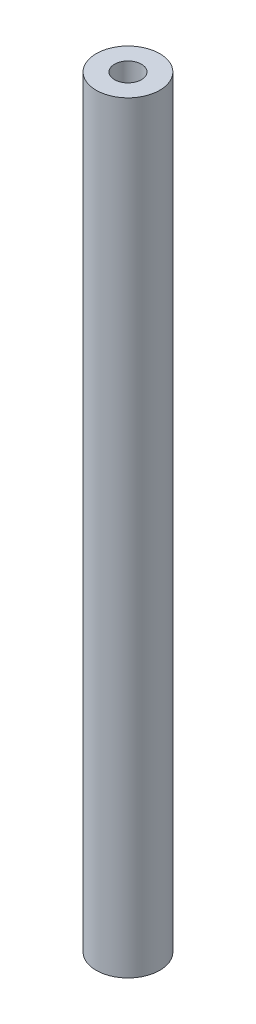
from build123d import *

# Parameters (mm, degrees)
SKETCH1_R                            = 4.7625
BOSS_EXTRUDE1_DEPTH                  = 57.15
F_10_32_TAPPED_HOLE1_D               = 4.0386
F_10_32_TAPPED_HOLE1_DEPTH           = 11.938
F_10_32_TAPPED_HOLE1_TIP             = 1.213317848
F_10_32_TAPPED_HOLE1_ON_FACE_2_D     = 4.0386
F_10_32_TAPPED_HOLE1_ON_FACE_2_DEPTH = 11.938
F_10_32_TAPPED_HOLE1_ON_FACE_2_TIP   = 1.213317848


with BuildPart() as part:
    # Sketch1 → Boss-Extrude1 (new, symmetric)
    with BuildSketch(Plane(origin=(0, 0, 0), x_dir=(1, 0, 0), z_dir=(0, 1, 0))):
        Circle(SKETCH1_R)
    extrude(amount=BOSS_EXTRUDE1_DEPTH, both=True)

    # #10-32 Tapped Hole1
    with Locations(Plane.ZX.offset(57.15)):
        with Locations((0, 0)):
            Hole(F_10_32_TAPPED_HOLE1_D / 2, depth=F_10_32_TAPPED_HOLE1_DEPTH)
            with Locations((0, 0, -(F_10_32_TAPPED_HOLE1_DEPTH + F_10_32_TAPPED_HOLE1_TIP / 2))):  # 118° drill point
                Cone(0, F_10_32_TAPPED_HOLE1_D / 2, F_10_32_TAPPED_HOLE1_TIP, mode=Mode.SUBTRACT)

    # #10-32 Tapped Hole1 on face 2
    with Locations(Plane(origin=(0, -57.15, 0), x_dir=(0, 0, -1), z_dir=(0, -1, 0))):
        with Locations((0, 0)):
            Hole(F_10_32_TAPPED_HOLE1_ON_FACE_2_D / 2, depth=F_10_32_TAPPED_HOLE1_ON_FACE_2_DEPTH)
            with Locations((0, 0, -(F_10_32_TAPPED_HOLE1_ON_FACE_2_DEPTH + F_10_32_TAPPED_HOLE1_ON_FACE_2_TIP / 2))):  # 118° drill point
                Cone(0, F_10_32_TAPPED_HOLE1_ON_FACE_2_D / 2, F_10_32_TAPPED_HOLE1_ON_FACE_2_TIP, mode=Mode.SUBTRACT)


solid = part.part
